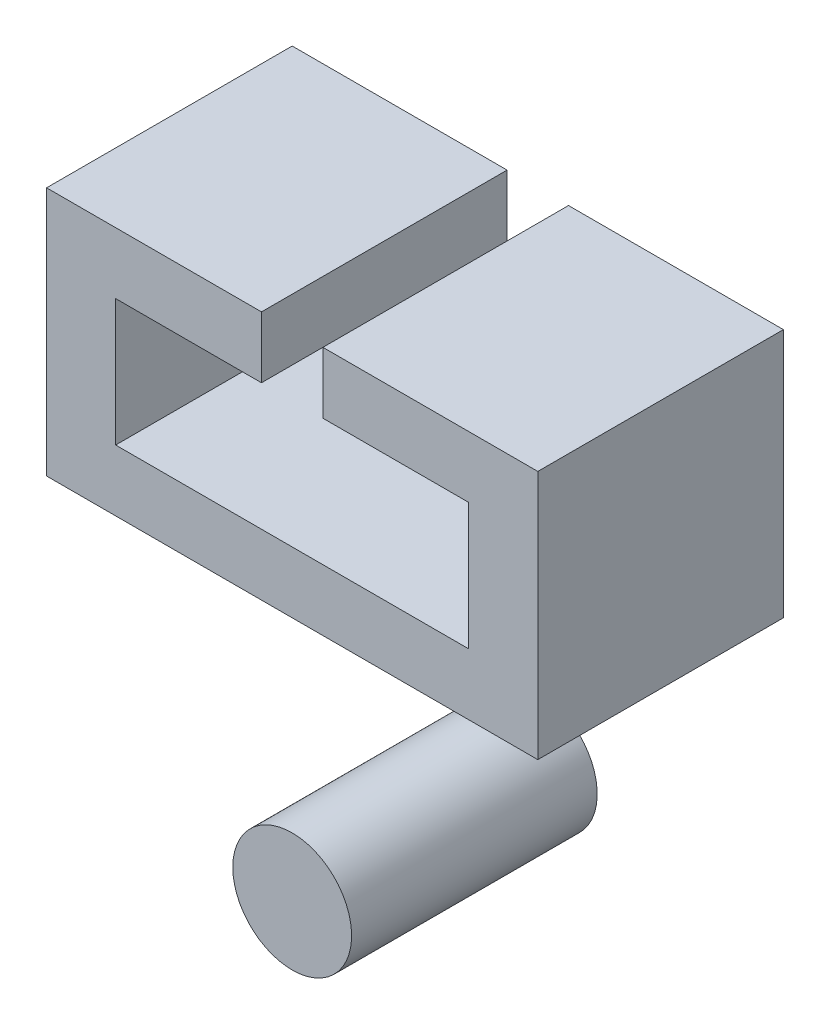
from build123d import *

# Parameters (mm, degrees)
SKETCH2_W           = 101.6
SKETCH2_H           = 51.632187404
BOSS_EXTRUDE1_DEPTH = 50.8
CUT_EXTRUDE1_DEPTH  = 125.776130635
SKETCH4_W           = 12.7
SKETCH4_H           = 4.51612
BOSS_EXTRUDE2_DEPTH = 50.8
SKETCH5_R           = 12.286768524
BOSS_EXTRUDE3_DEPTH = 50.8


with BuildPart() as part:
    # Sketch2 → Boss-Extrude1 (new body)
    with BuildSketch(Plane.XY):
        with Locations((50.8, 25.816093702)):
            Rectangle(SKETCH2_W, SKETCH2_H)
    extrude(amount=BOSS_EXTRUDE1_DEPTH)

    # Sketch3 → Cut-Extrude1 (cut, through all)
    with BuildSketch(Plane.XY.offset(50.8)):
        Polygon((44.45, 51.632187404), (44.45, 38.932187404), (14.285714286, 38.932187404), (14.285714286, 12.7), (87.314285714, 12.7), (87.314285714, 38.932187404), (57.15, 38.932187404), (57.15, 51.632187404), align=None)
    extrude(amount=-CUT_EXTRUDE1_DEPTH, mode=Mode.SUBTRACT)

    # Sketch4 → Boss-Extrude2 (add)
    with BuildSketch(Plane.XZ):
        with Locations((50.8, 2.25806)):
            Rectangle(SKETCH4_W, SKETCH4_H)
    extrude(amount=BOSS_EXTRUDE2_DEPTH)


with BuildPart() as body_2:
    # Sketch5 → Boss-Extrude3 (new body)
    with BuildSketch(Plane(origin=(0, 0, 0), x_dir=(-1, 0, 0), z_dir=(0, 0, -1))):
        with Locations((-50.8, -50.8)):
            Circle(SKETCH5_R)
    extrude(amount=-BOSS_EXTRUDE3_DEPTH)


solid = Compound([part.part, body_2.part])
